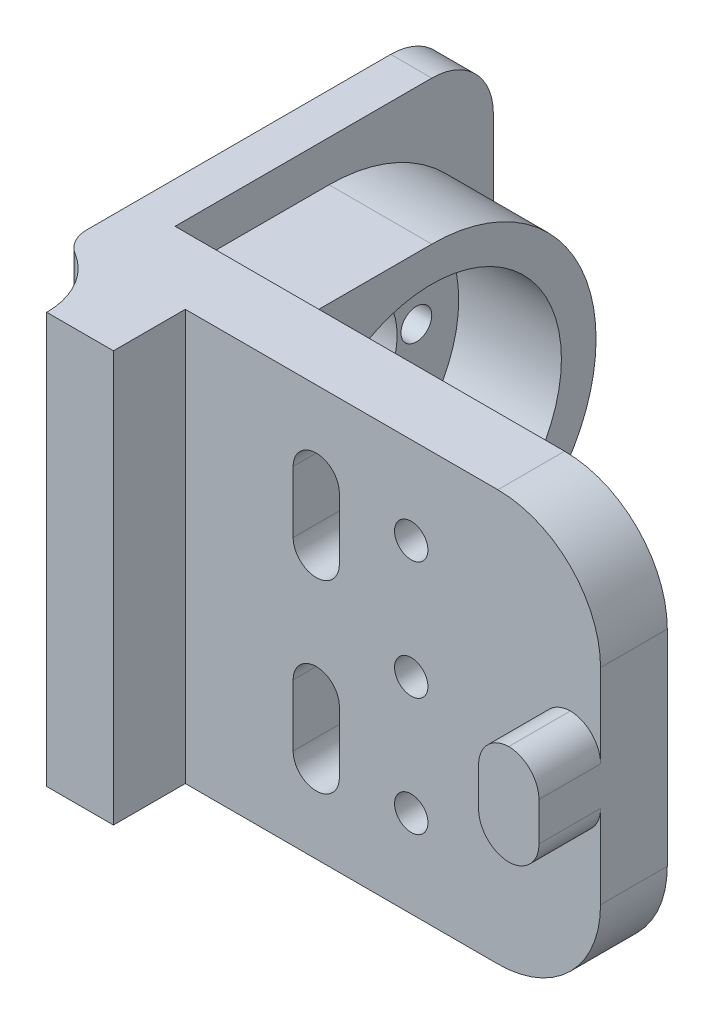
from build123d import *

# Parameters (mm, degrees)
ESBO_O1_W                  = 85
ESBO_O1_H                  = 40
RESSALTO_EXTRUS_O1_DEPTH   = 6.5
ESBO_O2_W                  = 11.5
ESBO_O2_H                  = 40
RESSALTO_EXTRUS_O2_DEPTH   = 7
CORTE_EXTRUS_O1_DEPTH      = 55.30469593
CORTE_EXTRUS_O1_DEPTH_BACK = 55.30469593
ESBO_O3_R                  = 1.625
ESBO_O6_R                  = 3.625
CORTE_EXTRUS_O3_DEPTH      = 3
ESBO_O7_W                  = 4
ESBO_O7_H                  = 40
RESSALTO_EXTRUS_O4_DEPTH   = 31
ESBO_O8_R                  = 12.625
RESSALTO_EXTRUS_O8_DEPTH   = 10
CORTE_EXTRUS_O4_DEPTH      = 90.0056178
CORTE_EXTRUS_O4_DEPTH_BACK = 90.0056178
ESBO_O10_R                 = 6.625
ESBO_O10_R_2               = 1.5
FILETE1_R                  = 6
CORTE_EXTRUS_O5_DEPTH      = 40
FILETE3_R                  = 3
CORTE_EXTRUS_O7_DEPTH      = 66.622023742
CORTE_EXTRUS_O7_DEPTH_BACK = 66.622023742
ESBO_O14_W                 = 5.875
ESBO_O14_H                 = 9.75
RESSALTO_EXTRUS_O9_DEPTH   = 6
FILETE4_R                  = 3
CORTE_EXTRUS_O8_DEPTH      = 66.622023742
CORTE_EXTRUS_O8_DEPTH_BACK = 66.622023742
ESBO_O15_W                 = 33.0625
ESBO_O15_H                 = 40
FILETE5_R                  = 10


with BuildPart() as part:
    # Esboço1 → Ressalto-extrusão1 (new body)
    with BuildSketch(Plane.XY):
        with Locations((-7.5, 0)):
            Rectangle(ESBO_O1_W, ESBO_O1_H)
    extrude(amount=RESSALTO_EXTRUS_O1_DEPTH)

    # Esboço2 → Ressalto-extrusão2 (add)
    with BuildSketch(Plane.XY.offset(6.5)):
        with Locations((-44.25, 0)):
            Rectangle(ESBO_O2_W, ESBO_O2_H)
    extrude(amount=RESSALTO_EXTRUS_O2_DEPTH)

    # Esboço3 → Corte-extrusão1 (cut, two sides: drawn at the far end of the back side and taken through both)
    with BuildSketch(Plane.XY.offset(6.5).offset(-CORTE_EXTRUS_O1_DEPTH_BACK)):
        with Locations((-16.5, -11.5)):
            Circle(ESBO_O3_R)
        with Locations((-16.5, 0)):
            Circle(ESBO_O3_R)
        with Locations((-16.5, 11.5)):
            Circle(ESBO_O3_R)
    extrude(amount=CORTE_EXTRUS_O1_DEPTH + CORTE_EXTRUS_O1_DEPTH_BACK, mode=Mode.SUBTRACT)

    # Esboço6 → Corte-extrusão3 (cut)
    with BuildSketch(Plane(origin=(0, 0, 0), x_dir=(-1, 0, 0), z_dir=(0, 0, -1))):
        with Locations((16.5, -11.5)):
            Circle(ESBO_O6_R)
        with Locations((16.5, 0)):
            Circle(ESBO_O6_R)
        with Locations((16.5, 11.5)):
            Circle(ESBO_O6_R)
    extrude(amount=-CORTE_EXTRUS_O3_DEPTH, mode=Mode.SUBTRACT)

    # Esboço7 → Ressalto-extrusão4 (add)
    with BuildSketch(Plane(origin=(0, 0, 0), x_dir=(-1, 0, 0), z_dir=(0, 0, -1))):
        with Locations((48, 0)):
            Rectangle(ESBO_O7_W, ESBO_O7_H)
    extrude(amount=RESSALTO_EXTRUS_O4_DEPTH)

    # Esboço8 → Ressalto-extrusão8 (add)
    with BuildSketch(Plane(origin=(-46, 0, 0), x_dir=(0, 0, -1), z_dir=(1, 0, 0))):
        with BuildLine():
            Line((15, -16), (0, -16))
            Line((0, -16), (0, 16))
            Line((0, 16), (15, 16))
            ThreePointArc((15, 16), (31, 0), (15, -16))
        make_face()
        with Locations((15, 0)):
            Circle(ESBO_O8_R, mode=Mode.SUBTRACT)
    extrude(amount=RESSALTO_EXTRUS_O8_DEPTH)

    # Esboço10 → Corte-extrusão4 (cut, two sides: drawn at the far end of the back side and taken through both)
    with BuildSketch(Plane(origin=(-46, 0, 0), x_dir=(0, 0, -1), z_dir=(1, 0, 0)).offset(-CORTE_EXTRUS_O4_DEPTH_BACK)):
        with Locations((15, 0)):
            Circle(ESBO_O10_R)
        with Locations((15, -8.5)):
            Circle(ESBO_O10_R_2)
        with Locations((6.5, 0)):
            Circle(ESBO_O10_R_2)
        with Locations((15, 8.5)):
            Circle(ESBO_O10_R_2)
        with Locations((23.5, 0)):
            Circle(ESBO_O10_R_2)
    extrude(amount=CORTE_EXTRUS_O4_DEPTH + CORTE_EXTRUS_O4_DEPTH_BACK, mode=Mode.SUBTRACT)

    # Filete1
    filete1_edges = [part.edges().sort_by_distance(p)[0] for p in [
        (-48, 20, -31),
        (-48, -20, -31),
    ]]
    fillet(filete1_edges, radius=FILETE1_R)

    # Esboço11 → Corte-extrusão5 (cut)
    with BuildSketch(Plane(origin=(0, 20, 0), x_dir=(1, 0, 0), z_dir=(0, 1, 0))):
        with BuildLine():
            Line((-50, -6.5), (-50, -13.5))
            Line((-50, -13.5), (-45, -13.5))
            ThreePointArc((-45, -13.5), (-46.378372313, -9.198837366), (-50, -6.5))
        make_face()
    extrude(amount=-CORTE_EXTRUS_O5_DEPTH, mode=Mode.SUBTRACT)

    # Filete3
    filete3_edges = [part.edges().sort_by_distance(p)[0] for p in [
        (-50, 0, 6.5),
    ]]
    fillet(filete3_edges, radius=FILETE3_R)

    # Esboço13 → Corte-extrusão7 (cut, two sides: drawn at the far end of the back side and taken through both)
    with BuildSketch(Plane.XY.offset(6.5).offset(-CORTE_EXTRUS_O7_DEPTH_BACK)):
        with BuildLine():
            Line((-28, -6), (-28, -12))
            ThreePointArc((-28, -12), (-25.75, -14.25), (-23.5, -12))
            Line((-23.5, -12), (-23.5, -6))
            ThreePointArc((-23.5, -6), (-25.75, -3.75), (-28, -6))
        make_face()
        with BuildLine():
            Line((-23.5, 6), (-23.5, 12))
            ThreePointArc((-23.5, 12), (-25.75, 14.25), (-28, 12))
            Line((-28, 12), (-28, 6))
            ThreePointArc((-28, 6), (-25.75, 3.75), (-23.5, 6))
        make_face()
    extrude(amount=CORTE_EXTRUS_O7_DEPTH + CORTE_EXTRUS_O7_DEPTH_BACK, mode=Mode.SUBTRACT)

    # Esboço14 → Ressalto-extrusão9 (add)
    with BuildSketch(Plane.XY.offset(6.5)):
        with Locations((-1, 0)):
            Rectangle(ESBO_O14_W, ESBO_O14_H)
    extrude(amount=RESSALTO_EXTRUS_O9_DEPTH)

    # Filete4
    # the kernel refuses this fillet: 3 mm, written as the material it takes off along each edge
    with BuildSketch(Plane(origin=(-3.9375, 4.875, 6.5), x_dir=(0, -1, 0), z_dir=(0, 0, 1)), Plane(origin=(-3.9375, -4.875, 6.5), x_dir=(1, 0, 0), z_dir=(0, 0, 1)), Plane(origin=(1.9375, 4.875, 6.5), x_dir=(-1, 0, 0), z_dir=(0, 0, 1))) as filete4_piece_1:
        with BuildLine():
            CenterArc((FILETE4_R, FILETE4_R), FILETE4_R, 180, 90)
            Line((0, FILETE4_R), (0, 0))
            Line((0, 0), (FILETE4_R, 0))
        make_face()
    extrude(amount=13.5, mode=Mode.SUBTRACT)
    with BuildSketch(Plane(origin=(1.9375, -4.875, 6.5), x_dir=(-1, 0, 0), z_dir=(0, 0, 1))) as filete4_piece_2:
        with BuildLine():
            CenterArc((FILETE4_R, -FILETE4_R), FILETE4_R, 90, 90)
            Line((0, -FILETE4_R), (0, 0))
            Line((0, 0), (FILETE4_R, 0))
        make_face()
    extrude(amount=13.5, mode=Mode.SUBTRACT)

    # Esboço15 → Corte-extrusão8 (cut, two sides: drawn at the far end of the back side and taken through both)
    with BuildSketch(Plane.XY.offset(6.5).offset(-CORTE_EXTRUS_O8_DEPTH_BACK)):
        with Locations((18.46875, 0)):
            Rectangle(ESBO_O15_W, ESBO_O15_H)
    extrude(amount=CORTE_EXTRUS_O8_DEPTH + CORTE_EXTRUS_O8_DEPTH_BACK, mode=Mode.SUBTRACT)

    # Filete5
    filete5_edges = [part.edges().sort_by_distance(p)[0] for p in [
        (1.9375, 20, 3.25),
        (1.9375, -20, 3.25),
    ]]
    fillet(filete5_edges, radius=FILETE5_R)


solid = part.part
